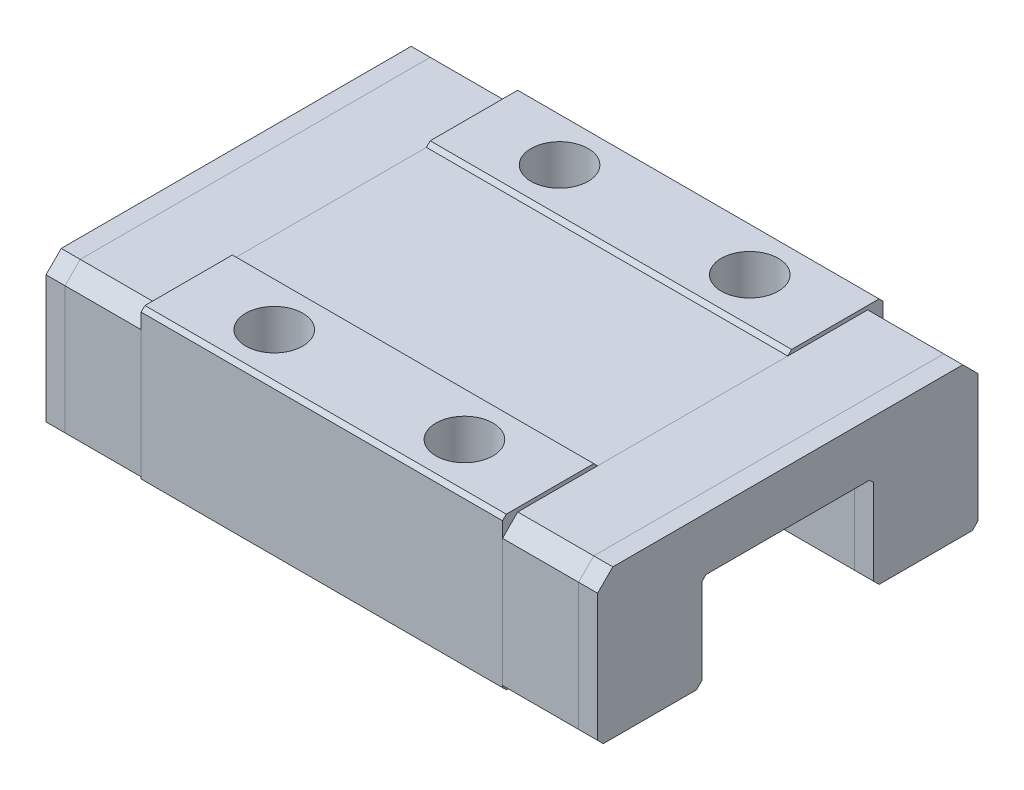
from build123d import *

# Parameters (mm, degrees)
SKETCH_1_W          = 19
SKETCH_1_H          = 20
EXTRUDE_1_DEPTH     = 8
SKETCH_2_W          = 19
SKETCH_2_H          = 10
CUT_EXTRUDE_1_DEPTH = 0.2
CHAMFER_1_SIZE      = 0.2
SKETCH_3_R          = 1.5
CUT_EXTRUDE_2_DEPTH = 6
SKETCH_4_W          = 10
SKETCH_4_H          = 5
CUT_EXTRUDE_3_DEPTH = 19
CHAMFER_2_SIZE      = 0.2
EXTRUDE_2_DEPTH     = 4
CHAMFER_3_SIZE      = 0.2
CHAMFER_4_SIZE      = 0.3
CHAMFER_5_SIZE      = 0.8
EXTRUDE_3_DEPTH     = 4
EXTRUDE_4_DEPTH     = 1
EXTRUDE_5_DEPTH     = 1


with BuildPart() as part:
    # 草图1 → 凸台-拉伸1 (new body)
    with BuildSketch(Plane(origin=(0, 0, 0), x_dir=(1, 0, 0), z_dir=(0, 1, 0))):
        Rectangle(SKETCH_1_W, SKETCH_1_H)
    extrude(amount=-EXTRUDE_1_DEPTH)

    # 草图2 → 切除-拉伸1 (cut)
    with BuildSketch(Plane(origin=(0, 0, 0), x_dir=(1, 0, 0), z_dir=(0, 1, 0))):
        Rectangle(SKETCH_2_W, SKETCH_2_H)
    extrude(amount=-CUT_EXTRUDE_1_DEPTH, mode=Mode.SUBTRACT)

    # 倒角1
    chamfer_1_edges = [part.edges().sort_by_distance(p)[0] for p in [
        (0, -8, 10),
        (0, -8, -10),
        (0, 0, -10),
        (0, 0, 10),
        (0, 0, 5),
        (0, 0, -5),
    ]]
    chamfer(chamfer_1_edges, length=CHAMFER_1_SIZE - 0.0001)  # a hair under: the kernel refuses the full size

    # 草图3 → 切除-拉伸2 (cut)
    with BuildSketch(Plane(origin=(0, 0, 0), x_dir=(1, 0, 0), z_dir=(0, 1, 0))):
        with Locations(Location((-5, 7.5, 0), (0, 0, 270))):
            Circle(SKETCH_3_R)
        with Locations(Location((5, 7.5, 0), (0, 0, 270))):
            Circle(SKETCH_3_R)
        with Locations(Location((5, -7.5, 0), (0, 0, 270))):
            Circle(SKETCH_3_R)
        with Locations(Location((-5, -7.5, 0), (0, 0, 270))):
            Circle(SKETCH_3_R)
    extrude(amount=-CUT_EXTRUDE_2_DEPTH, mode=Mode.SUBTRACT)

    # 草图4 → 切除-拉伸3 (cut)
    with BuildSketch(Plane(origin=(9.5, 0, 0), x_dir=(0, 0, -1), z_dir=(1, 0, 0))):
        with Locations((0, -5.5)):
            Rectangle(SKETCH_4_W, SKETCH_4_H)
    extrude(amount=-CUT_EXTRUDE_3_DEPTH, mode=Mode.SUBTRACT)

    # 倒角2
    chamfer_2_edges = [part.edges().sort_by_distance(p)[0] for p in [
        (0, -3, -5),
        (0, -3, 5),
        (0, -8, 5),
        (0, -8, -5),
    ]]
    chamfer(chamfer_2_edges, length=CHAMFER_2_SIZE)


with BuildPart() as body_2:
    # 草图5 → 凸台-拉伸2 (new body)
    with BuildSketch(Plane(origin=(9.5, 0, 0), x_dir=(0, 0, -1), z_dir=(1, 0, 0))):
        Polygon((-10, -0.2), (10, -0.2), (10, -8), (4.5, -8), (4.5, -3), (-4.5, -3), (-4.5, -8), (-10, -8), align=None)
    extrude(amount=EXTRUDE_2_DEPTH)

    # 倒角3
    chamfer_3_edges = [body_2.edges().sort_by_distance(p)[0] for p in [
        (11.5, -3, -4.5),
        (11.5, -3, 4.5),
    ]]
    chamfer(chamfer_3_edges, length=CHAMFER_3_SIZE)

    # 倒角4
    chamfer_4_edges = [body_2.edges().sort_by_distance(p)[0] for p in [
        (11.5, -8, -10),
        (11.5, -8, -4.5),
        (11.5, -8, 4.5),
        (11.5, -8, 10),
    ]]
    chamfer(chamfer_4_edges, length=CHAMFER_4_SIZE)

    # 倒角5
    chamfer_5_edges = [body_2.edges().sort_by_distance(p)[0] for p in [
        (11.5, -0.2, 10),
        (11.5, -0.2, -10),
    ]]
    chamfer(chamfer_5_edges, length=CHAMFER_5_SIZE)


with BuildPart() as body_3:
    # 草图6 → 凸台-拉伸3 (new body)
    with BuildSketch(Plane.ZY.offset(9.5)):
        Polygon((9.2, -0.2), (-9.2, -0.2), (-10, -1), (-10, -7.7), (-9.7, -8), (-4.8, -8), (-4.5, -7.7), (-4.5, -3.2), (-4.3, -3), (4.3, -3), (4.5, -3.2), (4.5, -7.7), (4.8, -8), (9.7, -8), (10, -7.7), (10, -1), align=None)
    extrude(amount=EXTRUDE_3_DEPTH)


with BuildPart() as body_4:
    # 草图7 → 凸台-拉伸4 (new body)
    with BuildSketch(Plane.ZY.offset(13.5)):
        Polygon((-9.2, -0.2), (-10, -1), (-10, -7.7), (-9.7, -8), (-4.8, -8), (-4.5, -7.7), (-4.5, -3.2), (-4.3, -3), (4.3, -3), (4.5, -3.2), (4.5, -7.7), (4.8, -8), (9.7, -8), (10, -7.7), (10, -1), (9.2, -0.2), align=None)
    extrude(amount=EXTRUDE_4_DEPTH)


with BuildPart() as body_5:
    # 草图8 → 凸台-拉伸5 (new body)
    with BuildSketch(Plane(origin=(13.5, 0, 0), x_dir=(0, 0, -1), z_dir=(1, 0, 0))):
        Polygon((9.2, -0.2), (-9.2, -0.2), (-10, -1), (-10, -7.7), (-9.7, -8), (-4.8, -8), (-4.5, -7.7), (-4.5, -3.2), (-4.3, -3), (4.3, -3), (4.5, -3.2), (4.5, -7.7), (4.8, -8), (9.7, -8), (10, -7.7), (10, -1), align=None)
    extrude(amount=EXTRUDE_5_DEPTH)


solid = Compound([part.part, body_2.part, body_3.part, body_4.part, body_5.part])
